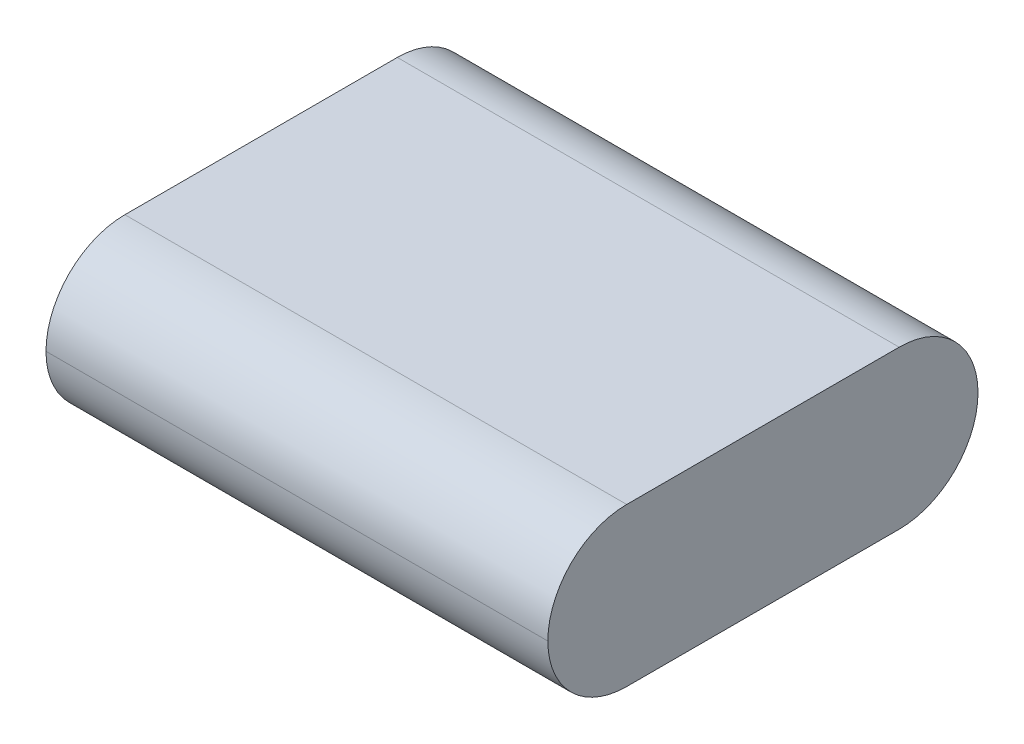
from build123d import *

# Parameters (mm, degrees)
SKETCH_1_W      = 70
SKETCH_1_H      = 60
EXTRUDE_1_DEPTH = 22
FILLET_1_R      = 11


with BuildPart() as part:
    # 草图1 → 凸台-拉伸1 (new body)
    with BuildSketch(Plane(origin=(0, 0, 0), x_dir=(1, 0, 0), z_dir=(0, 1, 0))):
        Rectangle(SKETCH_1_W, SKETCH_1_H)
    extrude(amount=EXTRUDE_1_DEPTH)

    # 圆角1
    fillet_1_edges = [part.edges().sort_by_distance(p)[0] for p in [
        (0, 0, -30),
        (0, 22, -30),
        (0, 0, 30),
        (0, 22, 30),
    ]]
    fillet(fillet_1_edges, radius=FILLET_1_R - 0.0001)  # a hair under: the kernel refuses the full size


solid = part.part
